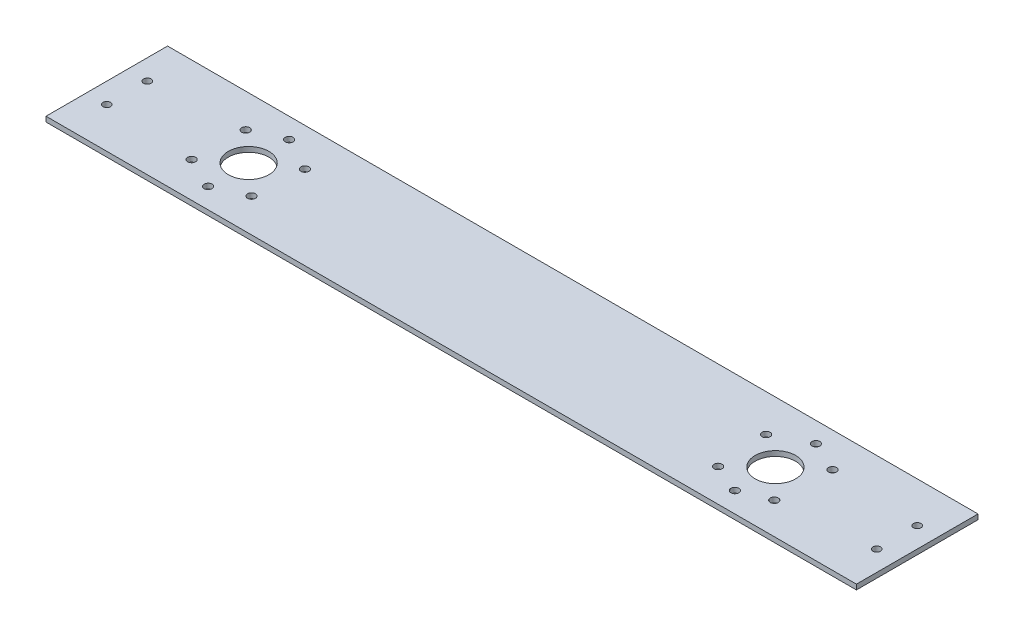
from build123d import *

# Parameters (mm, degrees)
SKETCH1_W               = 508
SKETCH1_H               = 76.2
BOSS_EXTRUDE1_DEPTH     = 3.175
SKETCH3_R               = 2.38125
CUT_EXTRUDE2_DEPTH      = 3.175
CUT_EXTRUDE3_DEPTH      = 257.861228341
CUT_EXTRUDE3_DEPTH_BACK = 257.861228341
SKETCH4_R               = 12.7
CUT_EXTRUDE4_DEPTH      = 257.861228341
CUT_EXTRUDE4_DEPTH_BACK = 257.861228341
SKETCH5_R               = 2.4892


with BuildPart() as part:
    # Sketch1 → Boss-Extrude1 (new body)
    with BuildSketch(Plane(origin=(0, 0, 0), x_dir=(1, 0, 0), z_dir=(0, 1, 0))):
        Rectangle(SKETCH1_W, SKETCH1_H)
    extrude(amount=BOSS_EXTRUDE1_DEPTH)

    # Sketch3 → Cut-Extrude2 (cut)
    with BuildSketch(Plane(origin=(0, 3.175, 0), x_dir=(1, 0, 0), z_dir=(0, 1, 0))):
        with Locations((-241.3, 12.7)):
            Circle(SKETCH3_R)
        with Locations((-241.3, -12.7)):
            Circle(SKETCH3_R)
        with Locations((241.3, -12.7)):
            Circle(SKETCH3_R)
        with Locations((241.3, 12.7)):
            Circle(SKETCH3_R)
    extrude(amount=-CUT_EXTRUDE2_DEPTH, mode=Mode.SUBTRACT)

    # Sketch4 → Cut-Extrude3 (cut, two sides: drawn at the far end of the back side and taken through both)
    with BuildSketch(Plane(origin=(0, 3.175, 0), x_dir=(1, 0, 0), z_dir=(0, 1, 0)).offset(-CUT_EXTRUDE3_DEPTH_BACK)):
        with Locations((-165.1, 0)):
            Circle(SKETCH4_R)
        with Locations((165.1, 0)):
            Circle(SKETCH4_R)
    extrude(amount=CUT_EXTRUDE3_DEPTH + CUT_EXTRUDE3_DEPTH_BACK, mode=Mode.SUBTRACT)

    # Sketch5 → Cut-Extrude4 (cut, two sides: drawn at the far end of the back side and taken through both)
    with BuildSketch(Plane(origin=(0, 3.175, 0), x_dir=(1, 0, 0), z_dir=(0, 1, 0)).offset(-CUT_EXTRUDE4_DEPTH_BACK)):
        with Locations((165.1, 25.4)):
            Circle(SKETCH5_R)
        with Locations((165.1, -25.4)):
            Circle(SKETCH5_R)
        with Locations((182.702284282, -18.311733617)):
            Circle(SKETCH5_R)
        with Locations((146.781232197, -17.594963659)):
            Circle(SKETCH5_R)
        with Locations((144.478364545, 14.829300427)):
            Circle(SKETCH5_R)
        with Locations((184.428439169, 16.479424725)):
            Circle(SKETCH5_R)
        with Locations((-165.1, 25.4)):
            Circle(SKETCH5_R)
        with Locations((-165.1, -25.4)):
            Circle(SKETCH5_R)
        with Locations((-146.252413932, -17.027286907)):
            Circle(SKETCH5_R)
        with Locations((-144.142590998, 14.350853909)):
            Circle(SKETCH5_R)
        with Locations((-183.94285118, 17.032526513)):
            Circle(SKETCH5_R)
        with Locations((-184.846603179, -15.975971422)):
            Circle(SKETCH5_R)
    extrude(amount=CUT_EXTRUDE4_DEPTH + CUT_EXTRUDE4_DEPTH_BACK, mode=Mode.SUBTRACT)


solid = part.part
